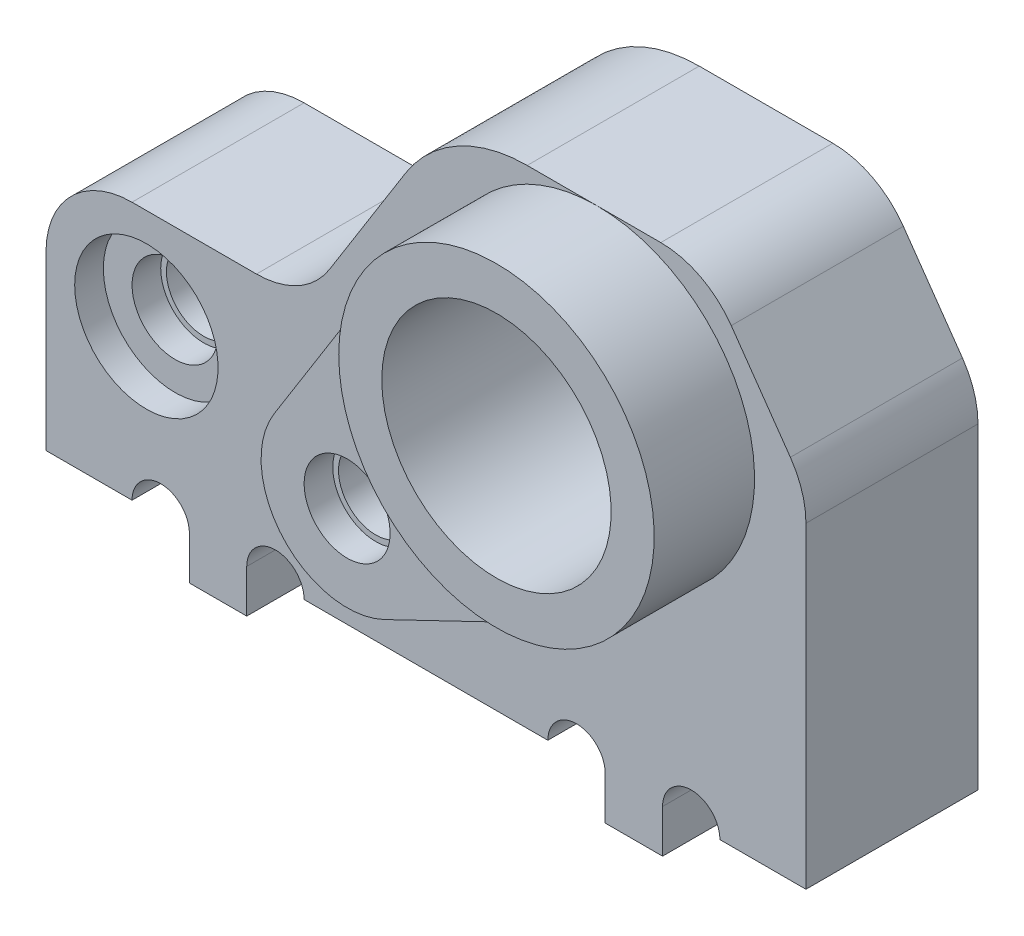
from build123d import *

# Parameters (mm, degrees)
SKETCH1_W             = 26.5
SKETCH1_H             = 6
BOSS_EXTRUDE1_DEPTH   = 17
SKETCH2_R             = 1.5
CUT_EXTRUDE1_DEPTH    = 1
SKETCH3_R             = 1.3
CUT_EXTRUDE2_DEPTH    = 32.878676259
SKETCH4_R             = 4
CUT_EXTRUDE3_DEPTH    = 33.050741021
SKETCH5_R             = 2.5
CUT_EXTRUDE4_DEPTH    = 1.5
SKETCH6_R             = 1.5
CUT_EXTRUDE8_DEPTH    = 1
SKETCH7_R             = 1.3
CUT_EXTRUDE9_DEPTH    = 32.678068123
CUT_EXTRUDE10_START   = -1
SKETCH8_R             = 2.5
CUT_EXTRUDE10_DEPTH   = 1
CUT_EXTRUDE11_START   = -1
SKETCH9_R             = 1.5
CUT_EXTRUDE11_DEPTH   = 1
SKETCH10_R            = 5.5
SKETCH10_R_2          = 4
BOSS_EXTRUDE2_DEPTH   = 3.5
SKETCH11_R            = 3
SKETCH11_R_2          = 1.3
BOSS_EXTRUDE4_DEPTH   = 2
CUT_EXTRUDE12_START   = -1
SKETCH12_R            = 1.5
CUT_EXTRUDE12_DEPTH   = 1
SKETCH17_W            = 2
SKETCH17_H            = 6
BOSS_EXTRUDE6_DEPTH   = 1.5
SKETCH18_R            = 1
CUT_EXTRUDE17_DEPTH   = 33.050741021
CHAMFER2_SIZE         = 5
CHAMFER2_SIZE2        = 3.5
FILLET11_R            = 3
BOSS_EXTRUDE7_DEPTH   = 2
CUT_EXTRUDE19_DEPTH   = 33.050741021
FILLET13_R            = 5
FILLET14_R            = 3
FILLET15_R            = 3
MIRROR6_OUTLINE_R     = 4
MIRROR6_OUTLINE_R_2   = 2.5
MIRROR6_OUTLINE_R_3   = 1.5
MIRROR6_DEPTH         = 6
MIRROR6_START         = 6
MIRROR6_2_OUTLINE_R   = 4
MIRROR6_2_OUTLINE_R_2 = 1.5
MIRROR6_2_DEPTH       = 2
MIRROR6_START_2       = 8
MIRROR6_3_OUTLINE_R   = 5.5
MIRROR6_3_OUTLINE_R_2 = 4
MIRROR6_3_DEPTH       = 1.5
MIRROR6_START_3       = 1.5
MIRROR6_4_OUTLINE_R   = 1.5
MIRROR6_4_OUTLINE_R_2 = 1.3
MIRROR6_4_OUTLINE_R_3 = 2.5
MIRROR6_4_DEPTH       = 3.5
MIRROR6_START_4       = 1
MIRROR6_5_OUTLINE_R   = 1.5
MIRROR6_5_OUTLINE_R_2 = 1.3
MIRROR6_5_DEPTH       = 6
MIRROR6_START_5       = 2.5
MIRROR6_6_OUTLINE_R   = 1.5
MIRROR6_6_OUTLINE_R_2 = 1.3
MIRROR6_6_DEPTH       = 1.5
CUT_EXTRUDE20_DEPTH   = 34.963215396


# Read off the part's stored shape, not the designer's step: Mirror6
with BuildPart() as part:
    # Sketch1 → Boss-Extrude1 (new body)
    with BuildSketch(Plane(origin=(0, 0, 0), x_dir=(1, 0, 0), z_dir=(0, 1, 0))):
        with Locations((13.25, 3)):
            Rectangle(SKETCH1_W, SKETCH1_H)
    extrude(amount=BOSS_EXTRUDE1_DEPTH)

    # Sketch2 → Cut-Extrude1 (cut)
    with BuildSketch(Plane.XY):
        with Locations((12.5, 5.5)):
            Circle(SKETCH2_R)
    extrude(amount=-CUT_EXTRUDE1_DEPTH, mode=Mode.SUBTRACT)

    # Sketch3 → Cut-Extrude2 (cut, through all)
    with BuildSketch(Plane.XY.offset(-1)):
        with Locations((12.5, 5.5)):
            Circle(SKETCH3_R)
    extrude(amount=-CUT_EXTRUDE2_DEPTH, mode=Mode.SUBTRACT)

    # Sketch4 → Cut-Extrude3 (cut, through all)
    with BuildSketch(Plane.XY):
        with Locations((19.208203932, 11.5)):
            Circle(SKETCH4_R)
    extrude(amount=-CUT_EXTRUDE3_DEPTH, mode=Mode.SUBTRACT)

    # Sketch5 → Cut-Extrude4 (cut)
    with BuildSketch(Plane.XY):
        with Locations((3.5, 5.5)):
            Circle(SKETCH5_R)
    extrude(amount=-CUT_EXTRUDE4_DEPTH, mode=Mode.SUBTRACT)

    # Sketch6 → Cut-Extrude8 (cut)
    with BuildSketch(Plane.XY.offset(-1.5)):
        with Locations((3.5, 5.5)):
            Circle(SKETCH6_R)
    extrude(amount=-CUT_EXTRUDE8_DEPTH, mode=Mode.SUBTRACT)

    # Sketch7 → Cut-Extrude9 (cut, through all)
    with BuildSketch(Plane.XY.offset(-2.5)):
        with Locations((3.5, 5.5)):
            Circle(SKETCH7_R)
    extrude(amount=-CUT_EXTRUDE9_DEPTH, mode=Mode.SUBTRACT)

    # Sketch8 → Cut-Extrude10 (cut)
    with BuildSketch(Plane(origin=(0, 0, -6), x_dir=(-1, 0, 0), z_dir=(0, 0, -1)).offset(CUT_EXTRUDE10_START)):
        with Locations(Location((-3.5, 5.5, 0), (0, 0, 180))):
            Circle(SKETCH8_R)
    extrude(amount=CUT_EXTRUDE10_DEPTH, mode=Mode.SUBTRACT)

    # Sketch9 → Cut-Extrude11 (cut)
    with BuildSketch(Plane(origin=(0, 0, -5), x_dir=(-1, 0, 0), z_dir=(0, 0, -1)).offset(CUT_EXTRUDE11_START)):
        with Locations(Location((-3.5, 5.5, 0), (0, 0, 180))):
            Circle(SKETCH9_R)
    extrude(amount=CUT_EXTRUDE11_DEPTH, mode=Mode.SUBTRACT)

    # Sketch10 → Boss-Extrude2 (add)
    with BuildSketch(Plane(origin=(0, 0, -6), x_dir=(-1, 0, 0), z_dir=(0, 0, -1))):
        with Locations(Location((-19.208203932, 11.5, 0), (0, 0, 90))):
            Circle(SKETCH10_R)
        with Locations(Location((-19.208203932, 11.5, 0), (0, 0, 180))):
            Circle(SKETCH10_R_2, mode=Mode.SUBTRACT)
    extrude(amount=BOSS_EXTRUDE2_DEPTH)

    # Sketch11 → Boss-Extrude4 (add)
    with BuildSketch(Plane(origin=(0, 0, -6), x_dir=(-1, 0, 0), z_dir=(0, 0, -1))):
        with Locations(Location((-12.5, 5.5, 0), (0, 0, 180))):
            Circle(SKETCH11_R)
        with Locations(Location((-12.5, 5.5, 0), (0, 0, 180))):
            Circle(SKETCH11_R_2, mode=Mode.SUBTRACT)
    extrude(amount=BOSS_EXTRUDE4_DEPTH)

    # Sketch12 → Cut-Extrude12 (cut)
    with BuildSketch(Plane(origin=(0, 0, -8), x_dir=(-1, 0, 0), z_dir=(0, 0, -1)).offset(CUT_EXTRUDE12_START)):
        with Locations(Location((-12.5, 5.5, 0), (0, 0, 180))):
            Circle(SKETCH12_R)
    extrude(amount=CUT_EXTRUDE12_DEPTH, mode=Mode.SUBTRACT)

    # Sketch17 → Boss-Extrude6 (add)
    with BuildSketch(Plane.XZ):
        with Locations((6, -3)):
            Rectangle(SKETCH17_W, SKETCH17_H)
        with Locations((20.5, -3)):
            Rectangle(SKETCH17_W, SKETCH17_H)
    extrude(amount=BOSS_EXTRUDE6_DEPTH)

    # Sketch18 → Cut-Extrude17 (cut, through all)
    with BuildSketch(Plane(origin=(0, 0, -6), x_dir=(-1, 0, 0), z_dir=(0, 0, -1))):
        with Locations((-22.5, 0)):
            Circle(SKETCH18_R)
        with Locations((-18.5, 0)):
            Circle(SKETCH18_R)
        with Locations((-8, 0)):
            Circle(SKETCH18_R)
        with Locations((-4, 0)):
            Circle(SKETCH18_R)
    extrude(amount=-CUT_EXTRUDE17_DEPTH, mode=Mode.SUBTRACT)

    # Chamfer2
    chamfer2_edges = [part.edges().sort_by_distance(p)[0] for p in [
        (26.5, 17, -3),
    ]]
    chamfer2_side = [part.faces().sort_by_distance(p)[0] for p in [
        (26.5, 8.5, -3),
    ]]
    chamfer(chamfer2_edges, length=CHAMFER2_SIZE, length2=CHAMFER2_SIZE2, reference=chamfer2_side[0])

    # Fillet11
    fillet11_edges = [part.edges().sort_by_distance(p)[0] for p in [
        (23, 17, -3),
        (26.5, 12, -3),
    ]]
    fillet(fillet11_edges, radius=FILLET11_R)

    # Sketch19 → Boss-Extrude7 (add)
    with BuildSketch(Plane(origin=(0, 0, -6), x_dir=(-1, 0, 0), z_dir=(0, 0, -1))):
        with BuildLine():
            Line((-14.547099294, 14.419606745), (-9.957579288, 7.09251277))
            ThreePointArc((-9.957579288, 7.09251277), (-14.736067977, 7.5), (-13.800160725, 2.796376119))
            Line((-13.800160725, 2.796376119), (-21.591831928, 6.543356218))
            ThreePointArc((-21.591831928, 6.543356218), (-15.108745974, 7.833333333), (-14.547099294, 14.419606745))
        make_face()
    extrude(amount=BOSS_EXTRUDE7_DEPTH)

    # Sketch20 → Cut-Extrude19 (cut, through all)
    with BuildSketch(Plane(origin=(0, 0, -6), x_dir=(-1, 0, 0), z_dir=(0, 0, -1))):
        Polygon((0, 17), (-14.011012575, 17), (-9, 9), (0, 9), align=None)
    extrude(amount=-CUT_EXTRUDE19_DEPTH, mode=Mode.SUBTRACT)

    # Fillet13
    fillet13_edges = [part.edges().sort_by_distance(p)[0] for p in [
        (14.011012575, 17, -3),
    ]]
    fillet(fillet13_edges, radius=FILLET13_R)

    # Fillet14
    fillet14_edges = [part.edges().sort_by_distance(p)[0] for p in [
        (9, 9, -3),
    ]]
    fillet(fillet14_edges, radius=FILLET14_R)

    # Fillet15
    fillet15_edges = [part.edges().sort_by_distance(p)[0] for p in [
        (0, 9, -3),
    ]]
    fillet(fillet15_edges, radius=FILLET15_R)

    # Mirror6 outline → Mirror6 (add)
    with BuildSketch(Plane.XY):
        with BuildLine():
            Line((21.438033315, 17), (16.779018718, 17))
            ThreePointArc((16.779018718, 17), (14.357339523, 16.374410803), (12.541650865, 14.65418795))
            Line((12.541650865, 14.65418795), (9.881617026, 10.40748723))
            ThreePointArc((9.881617026, 10.40748723), (8.792203831, 9.375353518), (7.339196314, 9))
            Line((7.339196314, 9), (3, 9))
            ThreePointArc((3, 9), (0.878679656, 8.121320344), (0, 6))
            Line((0, 6), (0, 0))
            Line((0, 0), (3, 0))
            ThreePointArc((3, 0), (4, 1), (5, 0))
            Line((5, 0), (5, -1.5))
            Line((5, -1.5), (7, -1.5))
            Line((7, -1.5), (7, 0))
            ThreePointArc((7, 0), (8, 1), (9, 0))
            Line((9, 0), (17.5, 0))
            ThreePointArc((17.5, 0), (18.5, 1), (19.5, 0))
            Line((19.5, 0), (19.5, -1.5))
            Line((19.5, -1.5), (21.5, -1.5))
            Line((21.5, -1.5), (21.5, 0))
            ThreePointArc((21.5, 0), (22.5, 1), (23.5, 0))
            Line((23.5, 0), (26.5, 0))
            Line((26.5, 0), (26.5, 11.054333308))
            ThreePointArc((26.5, 11.054333308), (26.361213666, 11.956251462), (25.957695762, 12.774720341))
            Line((25.957695762, 12.774720341), (23.895729077, 15.720387033))
            ThreePointArc((23.895729077, 15.720387033), (22.823464458, 16.660936029), (21.438033315, 17))
        make_face()
        with Locations((19.208203932, 11.5)):
            Circle(MIRROR6_OUTLINE_R, mode=Mode.SUBTRACT)
        with Locations((3.5, 5.5)):
            Circle(MIRROR6_OUTLINE_R_2, mode=Mode.SUBTRACT)
        with Locations((12.5, 5.5)):
            Circle(MIRROR6_OUTLINE_R_3, mode=Mode.SUBTRACT)
    extrude(amount=MIRROR6_DEPTH)

    # Mirror6 2 outline → Mirror6 2 (add)
    with BuildSketch(Plane.XY.offset(MIRROR6_START)):
        with BuildLine():
            Line((14.547099293, 14.419606745), (9.957579288, 7.09251277))
            ThreePointArc((9.957579288, 7.09251277), (10.263932023, 3.5), (13.800160725, 2.796376119))
            Line((13.800160725, 2.796376119), (21.591831928, 6.543356218))
            ThreePointArc((21.591831928, 6.543356218), (23.307661891, 15.166666667), (14.547099293, 14.419606745))
        make_face()
        with Locations((19.208203932, 11.5)):
            Circle(MIRROR6_2_OUTLINE_R, mode=Mode.SUBTRACT)
        with Locations((12.5, 5.5)):
            Circle(MIRROR6_2_OUTLINE_R_2, mode=Mode.SUBTRACT)
    extrude(amount=MIRROR6_2_DEPTH)

    # Mirror6 3 outline → Mirror6 3 (add)
    with BuildSketch(Plane.XY.offset(MIRROR6_START_2)):
        with Locations((19.208203932, 11.5)):
            Circle(MIRROR6_3_OUTLINE_R)
        with Locations((19.208203932, 11.5)):
            Circle(MIRROR6_3_OUTLINE_R_2, mode=Mode.SUBTRACT)
    extrude(amount=MIRROR6_3_DEPTH)

    # Mirror6 4 outline → Mirror6 4 (add)
    # profile 1 of 2: a face of its own
    with BuildSketch(Plane.XY.offset(MIRROR6_START_3)):
        with Locations((12.5, 5.5)):
            Circle(MIRROR6_4_OUTLINE_R)
        with Locations((12.5, 5.5)):
            Circle(MIRROR6_4_OUTLINE_R_2, mode=Mode.SUBTRACT)
    # profile 2 of 2: a face of its own
    with BuildSketch(Plane.XY.offset(MIRROR6_START_3)):
        with Locations((3.5, 5.5)):
            Circle(MIRROR6_4_OUTLINE_R_3)
        with Locations((3.5, 5.5)):
            Circle(MIRROR6_4_OUTLINE_R, mode=Mode.SUBTRACT)
    extrude(amount=MIRROR6_4_DEPTH)

    # Mirror6 5 outline → Mirror6 5 (add)
    with BuildSketch(Plane.XY.offset(MIRROR6_START_4)):
        with Locations((12.5, 5.5)):
            Circle(MIRROR6_5_OUTLINE_R)
        with Locations((12.5, 5.5)):
            Circle(MIRROR6_5_OUTLINE_R_2, mode=Mode.SUBTRACT)
    extrude(amount=MIRROR6_5_DEPTH)

    # Mirror6 6 outline → Mirror6 6 (add)
    with BuildSketch(Plane.XY.offset(MIRROR6_START_5)):
        with Locations((3.5, 5.5)):
            Circle(MIRROR6_6_OUTLINE_R)
        with Locations((3.5, 5.5)):
            Circle(MIRROR6_6_OUTLINE_R_2, mode=Mode.SUBTRACT)
    extrude(amount=MIRROR6_6_DEPTH)

    # Sketch24 → Cut-Extrude20 (cut, through all)
    with BuildSketch(Plane(origin=(0, -2, 0), x_dir=(1, 0, 0), z_dir=(0, 1, 0))):
        Polygon((0, 0), (26.5, 0), (26.5, 6), (26.5, 9.5), (24.708203932, 9.5), (13.708203932, 9.5), (0, 9.5), (0, 6), align=None)
    extrude(amount=CUT_EXTRUDE20_DEPTH, mode=Mode.SUBTRACT)


solid = part.part
